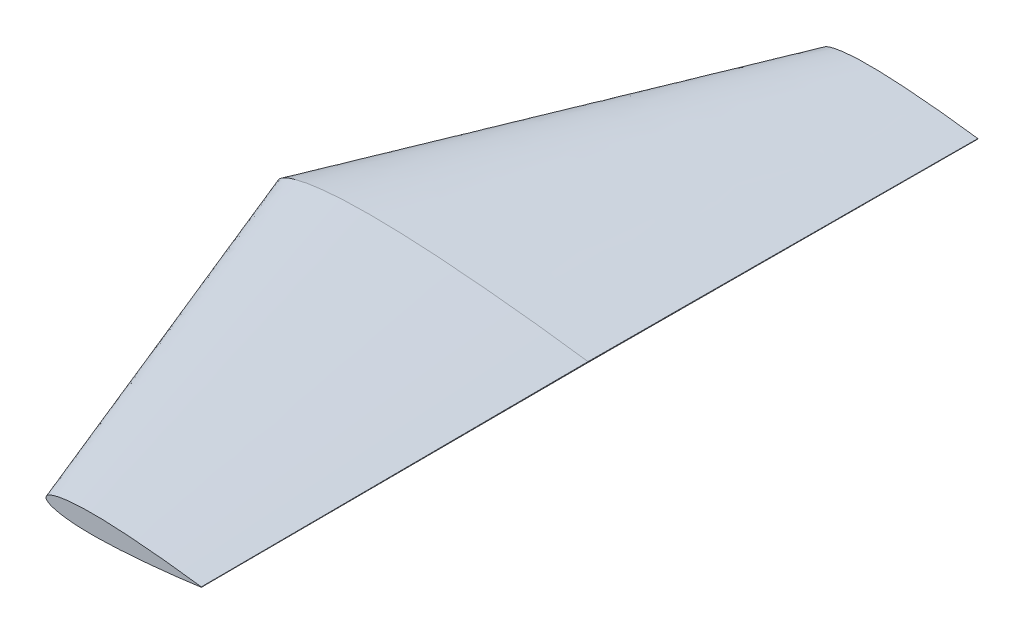
from build123d import *


with BuildPart() as part:
    # Sketch1 for Loft1 → Loft1 section 0
    with BuildSketch(Plane.XY):
        with BuildLine():
            # circular arc as an exact rational Bezier (weights 1, cos(half-angle), 1)
            Bezier((203.2, 0.256032), (203.985299386, 0), (203.2, -0.256032), weights=[1, 0.309972573, 1])
            add(Edge.make_bspline(
                [(203.2, 0.256032), (203.160444006, 0.26158808), (203.002362195, 0.283792432), (202.371452018, 0.372031236), (201.426998001, 0.503929296), (200.170946777, 0.677148757), (198.882114972, 0.854347737), (197.366011284, 1.060826609), (195.626228998, 1.295248031), (193.666888241, 1.556609567), (191.49254302, 1.843034787), (189.108259624, 2.153178269), (186.519557247, 2.484550519), (182.677653876, 2.969453015), (178.584221843, 3.472677933), (174.248732362, 3.991722924), (170.737886785, 4.403934983), (167.065446898, 4.825883481), (163.240198837, 5.256490831), (159.270956546, 5.692668058), (155.167116205, 6.133243682), (150.938101757, 6.575069268), (146.59388185, 7.017326061), (142.1445492, 7.45660377), (137.600565439, 7.891522736), (132.972482524, 8.319062257), (128.271096636, 8.737824539), (123.507416833, 9.144347741), (118.692544385, 9.536813527), (113.837785523, 9.912715546), (108.954416806, 10.269036244), (104.053914357, 10.603540812), (99.147717699, 10.913557285), (92.628697604, 11.289403433), (86.13903698, 11.606483183), (78.126464833, 11.915023622), (71.818514921, 12.088775754), (65.600486036, 12.179117605), (61.056186819, 12.202924123), (56.606542161, 12.181878588), (52.261965901, 12.115034784), (48.032638774, 12.000372627), (43.928344281, 11.838399519), (39.958659254, 11.627951646), (36.132825625, 11.369618862), (32.459852367, 11.063455033), (28.948278923, 10.710016616), (25.606264548, 10.310644367), (22.441513893, 9.866961624), (19.461482357, 9.379795449), (16.672999609, 8.851580621), (14.082483297, 8.284303305), (11.695987669, 7.679886516), (9.518786136, 7.04103794), (7.555679422, 6.369879191), (5.810853962, 5.668728302), (4.287763717, 4.939607963), (2.989310371, 4.184036166), (1.91700592, 3.403293753), (1.072922347, 2.596096448), (0.459095184, 1.760157594), (0.083800287, 0.891391222), (-0.040847769, 0), (0.083800287, -0.891391222), (0.459095184, -1.760157594), (1.072922347, -2.596096448), (1.91700592, -3.403293753), (2.989310371, -4.184036166), (4.287763717, -4.939607963), (5.810853962, -5.668728302), (7.555679422, -6.369879191), (9.518786136, -7.04103794), (11.695987669, -7.679886516), (14.082483297, -8.284303305), (16.672999609, -8.851580621), (19.461482357, -9.379795449), (22.441513893, -9.866961624), (25.606264548, -10.310644367), (28.948278923, -10.710016616), (32.459852367, -11.063455033), (36.132825625, -11.369618862), (39.958659254, -11.627951646), (43.928344281, -11.838399519), (48.032638774, -12.000372627), (52.261965901, -12.115034784), (56.606542161, -12.181878588), (61.056186819, -12.202924123), (65.600486036, -12.179117605), (71.818514921, -12.088775754), (79.747070765, -11.870384121), (87.758573777, -11.532017027), (94.247183136, -11.196091625), (99.147717699, -10.913557285), (104.053914357, -10.603540812), (108.954416806, -10.269036244), (113.837785523, -9.912715546), (118.692544385, -9.536813527), (123.507416833, -9.144347741), (128.271096636, -8.737824539), (132.972482524, -8.319062257), (137.600565439, -7.891522736), (142.1445492, -7.45660377), (146.59388185, -7.017326061), (150.938101757, -6.575069268), (155.167116205, -6.133243682), (159.270956546, -5.692668058), (163.240198837, -5.256490831), (167.065446898, -4.825883481), (170.737886785, -4.403934983), (174.248732362, -3.991722924), (178.584221843, -3.472677933), (182.677653876, -2.969453015), (186.519557247, -2.484550519), (189.108259624, -2.153178269), (191.49254302, -1.843034787), (193.666888241, -1.556609567), (195.626228998, -1.295248031), (197.366011284, -1.060826609), (198.882114972, -0.854347737), (200.170946777, -0.677148757), (201.426998001, -0.503929296), (202.371452018, -0.372031236), (203.002362195, -0.283792432), (203.160444006, -0.26158808), (203.2, -0.256032)],
                knots=[0, 0, 0, 0, 0.000289201, 0.001155766, 0.004612322, 0.007193518, 0.010335793, 0.014031397, 0.018271612, 0.023045847, 0.028342901, 0.03415012, 0.04045376, 0.04723833, 0.062186613, 0.070313724, 0.078851908, 0.087780126, 0.097077521, 0.106722049, 0.116690868, 0.126960505, 0.137507218, 0.148306055, 0.159330765, 0.17055649, 0.181956531, 0.193504043, 0.205171367, 0.2169323, 0.228758169, 0.2406214, 0.252494936, 0.264350287, 0.287897994, 0.299535854, 0.322404759, 0.333584032, 0.344559266, 0.35530596, 0.365799778, 0.37601757, 0.3859373, 0.395537659, 0.404797976, 0.413698812, 0.422221441, 0.430349273, 0.438066019, 0.445356904, 0.452209372, 0.458611567, 0.464554044, 0.47002985, 0.475034902, 0.479569141, 0.483636857, 0.487250263, 0.490431338, 0.493218828, 0.495674086, 0.497891368, 0.5, 0.502108632, 0.504325914, 0.506781172, 0.509568662, 0.512749737, 0.516363143, 0.520430859, 0.524965098, 0.52997015, 0.535445956, 0.541388433, 0.547790628, 0.554643096, 0.561933981, 0.569650727, 0.577778559, 0.586301188, 0.595202024, 0.604462341, 0.6140627, 0.62398243, 0.634200222, 0.64469404, 0.655440734, 0.666415968, 0.677595241, 0.700464146, 0.723839427, 0.735649713, 0.747505064, 0.7593786, 0.771241831, 0.7830677, 0.794828633, 0.806495957, 0.818043469, 0.82944351, 0.840669235, 0.851693945, 0.862492782, 0.873039495, 0.883309132, 0.893277951, 0.902922479, 0.912219874, 0.921148092, 0.929686276, 0.937813387, 0.95276167, 0.95954624, 0.96584988, 0.971657099, 0.976954153, 0.981728388, 0.985968603, 0.989664207, 0.992806482, 0.995387678, 0.998844234, 0.999710799, 1, 1, 1, 1], degree=3))
        make_face()
    # Sketch2 for Loft1 → Loft1 section 1
    with BuildSketch(Plane.XY.offset(254)):
        with BuildLine():
            Bezier((204.215999994, 0.128016), (205.149157327, -1e-09), (204.215999994, -0.128016), weights=[1, 0.135912893, 1])
            add(Edge.make_bspline(
                [(204.215999994, 0.128016), (204.196221998, 0.13079404), (204.117181092, 0.141896216), (203.801726004, 0.186015618), (203.329498995, 0.251964648), (202.701473383, 0.338574378), (202.057057481, 0.427173868), (201.299005637, 0.530413304), (200.429114494, 0.647624016), (199.449444115, 0.778304783), (198.362271505, 0.921517393), (197.170129807, 1.076589135), (195.875778619, 1.242275259), (193.954826933, 1.484726507), (191.908110917, 1.736338966), (189.740366176, 1.995861462), (187.984943388, 2.201967491), (186.148723444, 2.41294174), (184.236099414, 2.628245415), (182.251478269, 2.846334029), (180.199558098, 3.06662184), (178.085050874, 3.287534634), (175.912940921, 3.50866303), (173.688274596, 3.728301885), (171.416282716, 3.945761367), (169.102241258, 4.159531128), (166.751548314, 4.368912269), (164.369708413, 4.57217387), (161.962272189, 4.768406763), (159.534892758, 4.956357773), (157.0932084, 5.134518121), (154.642957176, 5.301770406), (152.189858847, 5.456778642), (148.930348799, 5.644701716), (145.685518488, 5.803241591), (141.679232414, 5.95751181), (138.525257459, 6.044387876), (135.416243016, 6.089558802), (133.144093408, 6.101462061), (130.919271079, 6.090939293), (128.746982949, 6.057517391), (126.632319386, 6.000186313), (124.580172139, 5.919199759), (122.595329626, 5.813975822), (120.682412811, 5.68480943), (118.845926183, 5.531727516), (117.090139461, 5.355008307), (115.419132273, 5.155322183), (113.836756946, 4.933480811), (112.346741178, 4.689897724), (110.952499804, 4.42579031), (109.657241648, 4.142151652), (108.463993834, 3.839943257), (107.375393067, 3.520518969), (106.393839711, 3.184939595), (105.521426981, 2.83436415), (104.759881858, 2.469803981), (104.110655185, 2.092018082), (103.57450296, 1.701646876), (103.152461174, 1.298048223), (102.845547592, 0.880078797), (102.657900144, 0.44569561), (102.595576116, -1e-09), (102.657900144, -0.445695611), (102.845547592, -0.880078798), (103.152461174, -1.298048224), (103.57450296, -1.701646877), (104.110655185, -2.092018083), (104.759881858, -2.469803982), (105.521426981, -2.834364151), (106.393839711, -3.184939596), (107.375393068, -3.52051897), (108.463993834, -3.839943258), (109.657241648, -4.142151653), (110.952499804, -4.425790311), (112.346741178, -4.689897725), (113.836756946, -4.933480812), (115.419132273, -5.155322184), (117.090139461, -5.355008308), (118.845926183, -5.531727517), (120.682412811, -5.684809431), (122.595329626, -5.813975823), (124.580172139, -5.91919976), (126.632319386, -6.000186313), (128.746982949, -6.057517392), (130.919271079, -6.090939294), (133.144093408, -6.101462062), (135.416243016, -6.089558803), (138.525257459, -6.044387877), (142.489535381, -5.93519206), (146.495286886, -5.766008513), (149.739591566, -5.598045812), (152.189858847, -5.456778643), (154.642957176, -5.301770406), (157.0932084, -5.134518122), (159.534892758, -4.956357773), (161.962272189, -4.768406763), (164.369708413, -4.572173871), (166.751548314, -4.36891227), (169.102241258, -4.159531128), (171.416282716, -3.945761368), (173.688274596, -3.728301885), (175.912940921, -3.50866303), (178.085050875, -3.287534634), (180.199558098, -3.066621841), (182.251478269, -2.846334029), (184.236099414, -2.628245415), (186.148723444, -2.412941741), (187.984943388, -2.201967491), (189.740366176, -1.995861462), (191.908110917, -1.736338966), (193.954826933, -1.484726508), (195.875778619, -1.24227526), (197.170129807, -1.076589135), (198.362271505, -0.921517394), (199.449444115, -0.778304783), (200.429114494, -0.647624016), (201.299005637, -0.530413304), (202.057057481, -0.427173868), (202.701473383, -0.338574378), (203.329498995, -0.251964648), (203.801726004, -0.186015618), (204.117181092, -0.141896216), (204.196221998, -0.13079404), (204.215999994, -0.128016)],
                knots=[0, 0, 0, 0, 0.000289201, 0.001155766, 0.004612322, 0.007193518, 0.010335793, 0.014031397, 0.018271612, 0.023045847, 0.028342901, 0.03415012, 0.04045376, 0.04723833, 0.062186613, 0.070313724, 0.078851908, 0.087780126, 0.097077521, 0.106722049, 0.116690868, 0.126960505, 0.137507218, 0.148306055, 0.159330765, 0.17055649, 0.181956531, 0.193504043, 0.205171367, 0.2169323, 0.228758169, 0.2406214, 0.252494936, 0.264350287, 0.287897994, 0.299535854, 0.322404759, 0.333584032, 0.344559266, 0.35530596, 0.365799778, 0.37601757, 0.3859373, 0.395537659, 0.404797976, 0.413698812, 0.422221441, 0.430349273, 0.438066019, 0.445356904, 0.452209372, 0.458611567, 0.464554044, 0.47002985, 0.475034902, 0.479569141, 0.483636857, 0.487250263, 0.490431338, 0.493218828, 0.495674086, 0.497891368, 0.5, 0.502108632, 0.504325914, 0.506781172, 0.509568662, 0.512749737, 0.516363143, 0.520430859, 0.524965098, 0.52997015, 0.535445956, 0.541388433, 0.547790628, 0.554643096, 0.561933981, 0.569650727, 0.577778559, 0.586301188, 0.595202024, 0.604462341, 0.6140627, 0.62398243, 0.634200222, 0.64469404, 0.655440734, 0.666415968, 0.677595241, 0.700464146, 0.723839427, 0.735649713, 0.747505064, 0.7593786, 0.771241831, 0.7830677, 0.794828633, 0.806495957, 0.818043469, 0.82944351, 0.840669235, 0.851693945, 0.862492782, 0.873039495, 0.883309132, 0.893277951, 0.902922479, 0.912219874, 0.921148092, 0.929686276, 0.937813387, 0.95276167, 0.95954624, 0.96584988, 0.971657099, 0.976954153, 0.981728388, 0.985968603, 0.989664207, 0.992806482, 0.995387678, 0.998844234, 0.999710799, 1, 1, 1, 1], degree=3))
        make_face()
    loft1 = loft()

    # Mirror1: Loft1 across plane
    add(loft1.mirror(Plane(origin=(0, 0, 0), x_dir=(1, 0, 0), z_dir=(0, 0, -1))))


solid = part.part
